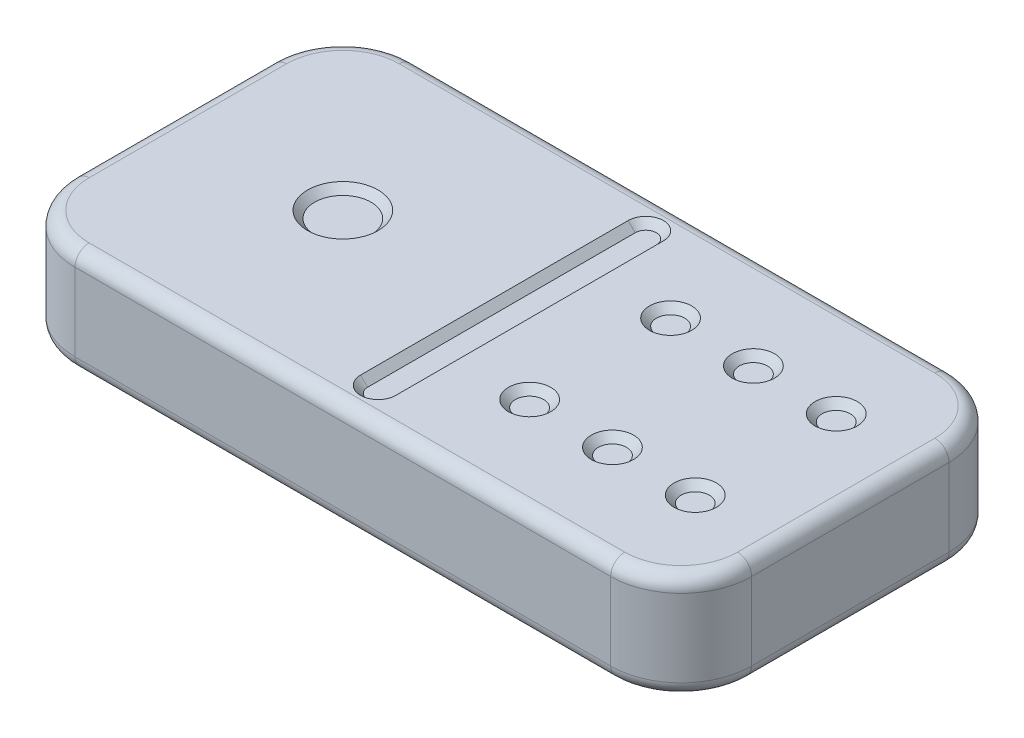
from build123d import *

# Parameters (mm, degrees)
ESQUISSE1_W                = 48
ESQUISSE1_H                = 24
EXTRUSION1_DEPTH           = 7.5
CONG_2_R                   = 5
CONG_5_R                   = 1
CONG_6_R                   = 1
ESQUISSE4_W                = 0.5
ESQUISSE4_H                = 18.982849842
EXTRUSION2_DEPTH           = 0.5
ESQUISSE5_R                = 0.25
EXTRUSION3_DEPTH           = 0.5
CHANFREIN1_SIZE            = 1
ESQUISSE10_R               = 2.5
EXTRUSION8_DEPTH           = 0.5
EXTRUSION8_DRAFT           = -45
ESQUISSE12_R               = 1.5
EXTRUSION9_DEPTH           = 0.5
EXTRUSION9_DRAFT           = -45
EXTRUSION9_PROFILE_2_DEPTH = 0.5
EXTRUSION9_PROFILE_2_DRAFT = -45
EXTRUSION9_PROFILE_3_DEPTH = 0.5
EXTRUSION9_PROFILE_3_DRAFT = -45
EXTRUSION9_PROFILE_4_DEPTH = 0.5
EXTRUSION9_PROFILE_4_DRAFT = -45
EXTRUSION9_PROFILE_5_DEPTH = 0.5
EXTRUSION9_PROFILE_5_DRAFT = -45
EXTRUSION9_PROFILE_6_DEPTH = 0.5
EXTRUSION9_PROFILE_6_DRAFT = -45


with BuildPart() as part:
    # Esquisse1 → Extrusion1 (new body)
    with BuildSketch(Plane(origin=(0, 0, 0), x_dir=(1, 0, 0), z_dir=(0, 1, 0))):
        with Locations((24, 12)):
            Rectangle(ESQUISSE1_W, ESQUISSE1_H)
    extrude(amount=EXTRUSION1_DEPTH)

    # Congé2
    cong_2_edges = [part.edges().sort_by_distance(p)[0] for p in [
        (0, 3.75, -24),
        (48, 3.75, -24),
        (48, 3.75, 0),
        (0, 3.75, 0),
    ]]
    fillet(cong_2_edges, radius=CONG_2_R)

    # Congé5
    cong_5_edges = [part.edges().sort_by_distance(p)[0] for p in [
        (48, 7.5, -12),
        (24, 7.5, 0),
        (0, 7.5, -12),
        (24, 7.5, -24),
        (1.464466094, 7.5, -22.535533906),
        (1.464466094, 7.5, -1.464466094),
        (46.535533906, 7.5, -22.535533906),
        (46.535533906, 7.5, -1.464466094),
    ]]
    fillet(cong_5_edges, radius=CONG_5_R)

    # Congé6
    cong_6_edges = [part.edges().sort_by_distance(p)[0] for p in [
        (48, 0, -12),
        (0, 0, -12),
        (24, 0, -24),
        (24, 0, 0),
        (1.464466094, 0, -22.535533906),
        (1.464466094, 0, -1.464466094),
        (46.535533906, 0, -22.535533906),
        (46.535533906, 0, -1.464466094),
    ]]
    fillet(cong_6_edges, radius=CONG_6_R)

    # Esquisse4 → Extrusion2 (cut)
    with BuildSketch(Plane(origin=(0, 7.5, 0), x_dir=(1, 0, 0), z_dir=(0, 1, 0))):
        with Locations((24, 12)):
            Rectangle(ESQUISSE4_W, ESQUISSE4_H)
    extrude(amount=-EXTRUSION2_DEPTH, mode=Mode.SUBTRACT)

    # Esquisse5 → Extrusion3 (cut)
    with BuildSketch(Plane(origin=(0, 7.5, 0), x_dir=(1, 0, 0), z_dir=(0, 1, 0))):
        with Locations((24, 21.491424921)):
            Circle(ESQUISSE5_R)
        with Locations((24, 2.508575079)):
            Circle(ESQUISSE5_R)
    extrude(amount=-EXTRUSION3_DEPTH, mode=Mode.SUBTRACT)

    # Chanfrein1
    # the kernel refuses this chamfer: 1 mm, written as the material it takes off along each edge
    with BuildSketch(Plane(origin=(24, 7.5, -21.491424921), x_dir=(1, 0, 0), z_dir=(0, 0, 1))) as chanfrein1_piece_1_section:
        Polygon((0.25 + CHANFREIN1_SIZE, 0), (0.25, -CHANFREIN1_SIZE), (0.25, 0), align=None)
    chanfrein1_piece_1 = revolve(axis=Axis((24, 7.5, -21.491424921), (0, 1, 0)), revolution_arc=180, mode=Mode.PRIVATE)
    chanfrein1_piece_1 = split(chanfrein1_piece_1, bisect_by=Plane(origin=(24, 7, -21.964580549), z_dir=(0, 1, 0)), keep=Keep.TOP, mode=Mode.PRIVATE)
    add(chanfrein1_piece_1, mode=Mode.SUBTRACT)
    with BuildSketch(Plane(origin=(24.25, 7.5, -21.491424921), x_dir=(0.9996219169112968, 0.02749587661058651, 0), z_dir=(0, 0, 1))) as chanfrein1_piece_2_section:
        Polygon((CHANFREIN1_SIZE * 0.999621916911, -CHANFREIN1_SIZE * 0.0274958766106), (-CHANFREIN1_SIZE * 0.0274958766106, -CHANFREIN1_SIZE * 0.999621916911), (0, 0), align=None)
    chanfrein1_piece_2 = extrude(amount=18.982849842, mode=Mode.PRIVATE)
    chanfrein1_piece_2 = split(chanfrein1_piece_2, bisect_by=Plane(origin=(24.643401084, 7, -12), z_dir=(0, 1, 0)), keep=Keep.TOP, mode=Mode.PRIVATE)
    add(chanfrein1_piece_2, mode=Mode.SUBTRACT)
    with BuildSketch(Plane(origin=(24, 7.5, -2.508575079), x_dir=(-1, 0, 0), z_dir=(0, 0, -1))) as chanfrein1_piece_3_section:
        Polygon((0.25 + CHANFREIN1_SIZE, 0), (0.25, -CHANFREIN1_SIZE), (0.25, 0), align=None)
    chanfrein1_piece_3 = revolve(axis=Axis((24, 7.5, -2.508575079), (0, 1, 0)), revolution_arc=180, mode=Mode.PRIVATE)
    chanfrein1_piece_3 = split(chanfrein1_piece_3, bisect_by=Plane(origin=(24, 7, -2.035419451), z_dir=(0, 1, 0)), keep=Keep.TOP, mode=Mode.PRIVATE)
    add(chanfrein1_piece_3, mode=Mode.SUBTRACT)
    with BuildSketch(Plane(origin=(23.75, 7.5, -2.508575079), x_dir=(-0.9996219169112968, 0.02749587661058651, 0), z_dir=(0, 0, -1))) as chanfrein1_piece_4_section:
        Polygon((CHANFREIN1_SIZE * 0.999621916911, -CHANFREIN1_SIZE * 0.0274958766106), (-CHANFREIN1_SIZE * 0.0274958766106, -CHANFREIN1_SIZE * 0.999621916911), (0, 0), align=None)
    chanfrein1_piece_4 = extrude(amount=18.982849842, mode=Mode.PRIVATE)
    chanfrein1_piece_4 = split(chanfrein1_piece_4, bisect_by=Plane(origin=(23.356598916, 7, -12), z_dir=(0, 1, 0)), keep=Keep.TOP, mode=Mode.PRIVATE)
    add(chanfrein1_piece_4, mode=Mode.SUBTRACT)


with BuildPart() as extrusion8_tool:
    # Esquisse10 → Extrusion8 (with draft: the straight prism first)
    with BuildSketch(Plane(origin=(0, 7.5, 0), x_dir=(1, 0, 0), z_dir=(0, 1, 0))):
        with Locations((12, 12)):
            Circle(ESQUISSE10_R)
    extrude(amount=-EXTRUSION8_DEPTH)
    # Extrusion8: the draft: its side faces are tilted about the plane it starts from
    extrusion8_sides = [extrusion8_tool.faces().sort_by_distance(p)[0] for p in [
        (9.5, 7.25, -12),
    ]]
    draft(extrusion8_sides, Plane(origin=(0, 7.5, 0), x_dir=(1, 0, 0), z_dir=(0, 1, 0)), EXTRUSION8_DRAFT)


with BuildPart() as part_1:
    add(part.part)

    # Extrusion8: cut by extrusion8_tool
    add(extrusion8_tool.part, mode=Mode.SUBTRACT)


with BuildPart() as extrusion9_tool:
    # Esquisse12 → Extrusion9 (with draft: the straight prism first)
    with BuildSketch(Plane(origin=(0, 7.5, 0), x_dir=(1, 0, 0), z_dir=(0, 1, 0))):
        with Locations((30.25, 17)):
            Circle(ESQUISSE12_R)
    extrude(amount=-EXTRUSION9_DEPTH)
    # Extrusion9: the draft: its side faces are tilted about the plane it starts from
    extrusion9_sides = [extrusion9_tool.faces().sort_by_distance(p)[0] for p in [
        (28.75, 7.25, -17),
    ]]
    draft(extrusion9_sides, Plane(origin=(0, 7.5, 0), x_dir=(1, 0, 0), z_dir=(0, 1, 0)), EXTRUSION9_DRAFT)


with BuildPart() as part_2:
    add(part_1.part)

    # Extrusion9: cut by extrusion9_tool
    add(extrusion9_tool.part, mode=Mode.SUBTRACT)


with BuildPart() as extrusion9_profile_2_tool:
    # Esquisse12 → Extrusion9 profile 2 (with draft: the straight prism first)
    with BuildSketch(Plane(origin=(0, 7.5, 0), x_dir=(1, 0, 0), z_dir=(0, 1, 0))):
        with Locations((36.125, 17)):
            Circle(ESQUISSE12_R)
    extrude(amount=-EXTRUSION9_PROFILE_2_DEPTH)
    # Extrusion9 profile 2: the draft: its side faces are tilted about the plane it starts from
    extrusion9_profile_2_sides = [extrusion9_profile_2_tool.faces().sort_by_distance(p)[0] for p in [
        (34.625, 7.25, -17),
    ]]
    draft(extrusion9_profile_2_sides, Plane(origin=(0, 7.5, 0), x_dir=(1, 0, 0), z_dir=(0, 1, 0)), EXTRUSION9_PROFILE_2_DRAFT)


with BuildPart() as part_3:
    add(part_2.part)

    # Extrusion9 profile 2: cut by extrusion9_profile_2_tool
    add(extrusion9_profile_2_tool.part, mode=Mode.SUBTRACT)


with BuildPart() as extrusion9_profile_3_tool:
    # Esquisse12 → Extrusion9 profile 3 (with draft: the straight prism first)
    with BuildSketch(Plane(origin=(0, 7.5, 0), x_dir=(1, 0, 0), z_dir=(0, 1, 0))):
        with Locations((42, 17)):
            Circle(ESQUISSE12_R)
    extrude(amount=-EXTRUSION9_PROFILE_3_DEPTH)
    # Extrusion9 profile 3: the draft: its side faces are tilted about the plane it starts from
    extrusion9_profile_3_sides = [extrusion9_profile_3_tool.faces().sort_by_distance(p)[0] for p in [
        (40.5, 7.25, -17),
    ]]
    draft(extrusion9_profile_3_sides, Plane(origin=(0, 7.5, 0), x_dir=(1, 0, 0), z_dir=(0, 1, 0)), EXTRUSION9_PROFILE_3_DRAFT)


with BuildPart() as part_4:
    add(part_3.part)

    # Extrusion9 profile 3: cut by extrusion9_profile_3_tool
    add(extrusion9_profile_3_tool.part, mode=Mode.SUBTRACT)


with BuildPart() as extrusion9_profile_4_tool:
    # Esquisse12 → Extrusion9 profile 4 (with draft: the straight prism first)
    with BuildSketch(Plane(origin=(0, 7.5, 0), x_dir=(1, 0, 0), z_dir=(0, 1, 0))):
        with Locations((30.25, 7)):
            Circle(ESQUISSE12_R)
    extrude(amount=-EXTRUSION9_PROFILE_4_DEPTH)
    # Extrusion9 profile 4: the draft: its side faces are tilted about the plane it starts from
    extrusion9_profile_4_sides = [extrusion9_profile_4_tool.faces().sort_by_distance(p)[0] for p in [
        (28.75, 7.25, -7),
    ]]
    draft(extrusion9_profile_4_sides, Plane(origin=(0, 7.5, 0), x_dir=(1, 0, 0), z_dir=(0, 1, 0)), EXTRUSION9_PROFILE_4_DRAFT)


with BuildPart() as part_5:
    add(part_4.part)

    # Extrusion9 profile 4: cut by extrusion9_profile_4_tool
    add(extrusion9_profile_4_tool.part, mode=Mode.SUBTRACT)


with BuildPart() as extrusion9_profile_5_tool:
    # Esquisse12 → Extrusion9 profile 5 (with draft: the straight prism first)
    with BuildSketch(Plane(origin=(0, 7.5, 0), x_dir=(1, 0, 0), z_dir=(0, 1, 0))):
        with Locations((36.125, 7)):
            Circle(ESQUISSE12_R)
    extrude(amount=-EXTRUSION9_PROFILE_5_DEPTH)
    # Extrusion9 profile 5: the draft: its side faces are tilted about the plane it starts from
    extrusion9_profile_5_sides = [extrusion9_profile_5_tool.faces().sort_by_distance(p)[0] for p in [
        (34.625, 7.25, -7),
    ]]
    draft(extrusion9_profile_5_sides, Plane(origin=(0, 7.5, 0), x_dir=(1, 0, 0), z_dir=(0, 1, 0)), EXTRUSION9_PROFILE_5_DRAFT)


with BuildPart() as part_6:
    add(part_5.part)

    # Extrusion9 profile 5: cut by extrusion9_profile_5_tool
    add(extrusion9_profile_5_tool.part, mode=Mode.SUBTRACT)


with BuildPart() as extrusion9_profile_6_tool:
    # Esquisse12 → Extrusion9 profile 6 (with draft: the straight prism first)
    with BuildSketch(Plane(origin=(0, 7.5, 0), x_dir=(1, 0, 0), z_dir=(0, 1, 0))):
        with Locations((42, 7)):
            Circle(ESQUISSE12_R)
    extrude(amount=-EXTRUSION9_PROFILE_6_DEPTH)
    # Extrusion9 profile 6: the draft: its side faces are tilted about the plane it starts from
    extrusion9_profile_6_sides = [extrusion9_profile_6_tool.faces().sort_by_distance(p)[0] for p in [
        (40.5, 7.25, -7),
    ]]
    draft(extrusion9_profile_6_sides, Plane(origin=(0, 7.5, 0), x_dir=(1, 0, 0), z_dir=(0, 1, 0)), EXTRUSION9_PROFILE_6_DRAFT)


with BuildPart() as part_7:
    add(part_6.part)

    # Extrusion9 profile 6: cut by extrusion9_profile_6_tool
    add(extrusion9_profile_6_tool.part, mode=Mode.SUBTRACT)


solid = part_7.part
